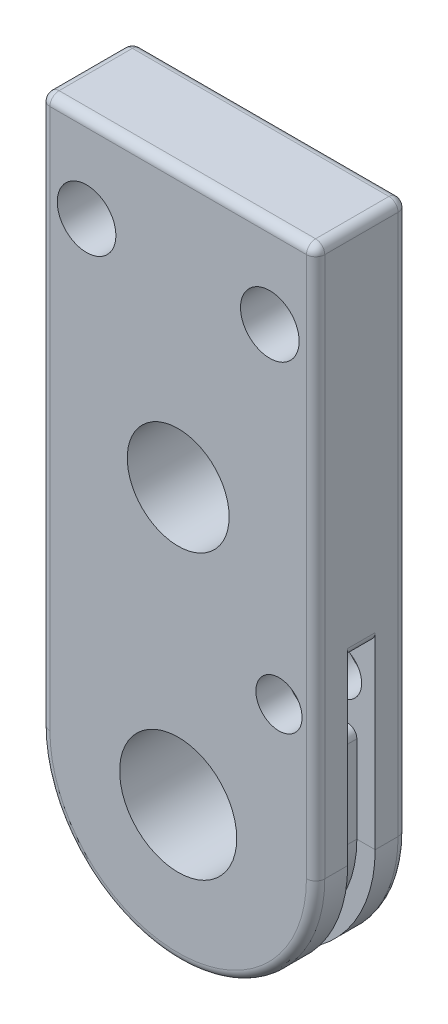
from build123d import *

# Parameters (mm, degrees)
SKETCH1_R           = 4.05765
SKETCH1_R_2         = 3.5306
SKETCH1_R_3         = 2.032
SKETCH1_R_4         = 1.6002
BOSS_EXTRUDE1_DEPTH = 3.175
SKETCH1_7_R         = 1.6002
CUT_EXTRUDE4_DEPTH  = 0.9525
SKETCH3_W           = 1.27
SKETCH3_H           = 1.905
FILLET1_R           = 0.635
FILLET2_R           = 0.635


with BuildPart() as part:
    # Sketch1 → Boss-Extrude1 (new, symmetric)
    with BuildSketch(Plane.XY):
        with BuildLine():
            Line((9.525, 38.1), (9.525, 0))
            ThreePointArc((9.525, 0), (0, -9.525), (-9.525, 0))
            Line((-9.525, 0), (-9.525, 38.1))
            Line((-9.525, 38.1), (9.525, 38.1))
        make_face()
        Circle(SKETCH1_R, mode=Mode.SUBTRACT)
        with Locations((0, 19.05)):
            Circle(SKETCH1_R_2, mode=Mode.SUBTRACT)
        with Locations((-6.35, 32.004)):
            Circle(SKETCH1_R_3, mode=Mode.SUBTRACT)
        with Locations((6.35, 32.004)):
            Circle(SKETCH1_R_3, mode=Mode.SUBTRACT)
        with Locations((6.985, 9.525)):
            Circle(SKETCH1_R_4, mode=Mode.SUBTRACT)
    extrude(amount=BOSS_EXTRUDE1_DEPTH, both=True)

    # Sketch1<7> → Cut-Extrude4 (cut, symmetric)
    with BuildSketch(Plane.XY):
        with BuildLine():
            Line((9.525, 6.6548), (9.525, 12.3952))
            Line((9.525, 12.3952), (6.985, 12.3952))
            ThreePointArc((6.985, 12.3952), (4.1148, 9.525), (6.985, 6.6548))
            Line((6.985, 6.6548), (9.525, 6.6548))
        make_face()
        with Locations((6.985, 9.525)):
            Circle(SKETCH1_7_R, mode=Mode.SUBTRACT)
    extrude(amount=CUT_EXTRUDE4_DEPTH, both=True, mode=Mode.SUBTRACT)

    # Cut-Sweep1: sweep along a path in Sketch2
    with BuildLine(Plane.XY.offset(3.175)) as cut_sweep1_path:
        Line((9.525, 6.6548), (9.525, 0))
        ThreePointArc((9.525, 0), (0, -9.525), (-9.525, 0))
        Line((-9.525, 0), (-9.525, 6.35))
    # Sketch3 → Cut-Sweep1 (sweep, cut)
    with BuildSketch(Plane(origin=(0, 6.6548, 0), x_dir=(1, 0, 0), z_dir=(0, 1, 0))):
        with Locations((8.89, 0)):
            Rectangle(SKETCH3_W, SKETCH3_H)
    sweep(path=cut_sweep1_path.line, mode=Mode.SUBTRACT)

    # Fillet1
    fillet1_edges = [part.edges().sort_by_distance(p)[0] for p in [
        (0, -9.525, 3.175),
        (-9.525, 19.05, -3.175),
        (0, 38.1, -3.175),
        (9.525, 19.05, 3.175),
        (9.525, 19.05, -3.175),
        (0, -9.525, -3.175),
        (-9.525, 38.1, 0),
        (9.525, 38.1, 0),
        (0, 38.1, 3.175),
        (-9.525, 19.05, 3.175),
    ]]
    fillet(fillet1_edges, radius=FILLET1_R)

    # Fillet2
    fillet2_edges = [part.edges().sort_by_distance(p)[0] for p in [
        (8.255, 6.6548, 0),
        (9.525, 12.3952, 0),
        (-9.525, 6.35, 0),
        (-8.255, 6.35, 0),
    ]]
    fillet(fillet2_edges, radius=FILLET2_R - 0.0001)  # a hair under: the kernel refuses the full size


solid = part.part
